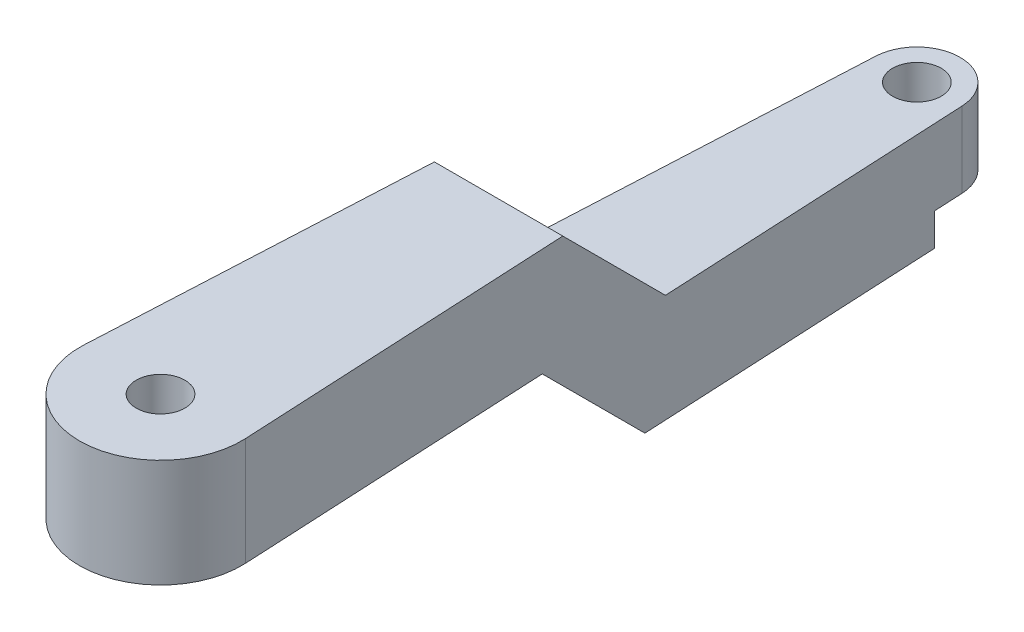
from build123d import *

# Parameters (mm, degrees)
SKETCH1_R           = 1.125
BOSS_EXTRUDE1_DEPTH = 10
CUT_EXTRUDE1_START  = -5
SKETCH2_R           = 1.125
CUT_EXTRUDE1_DEPTH  = 5
CUT_EXTRUDE3_START  = -10
SKETCH2_4_R         = 1.125
CUT_EXTRUDE3_DEPTH  = 5
CHAMFER1_SIZE       = 5
CUT_EXTRUDE4_DEPTH  = 1.5


with BuildPart() as part:
    # Sketch1 → Boss-Extrude1 (new body)
    with BuildSketch(Plane(origin=(0, 0, 0), x_dir=(1, 0, 0), z_dir=(0, 1, 0))):
        with BuildLine():
            ThreePointArc((-3.745309567, 0.1875), (0, -3.75), (3.745309567, 0.1875))
            Line((3.745309567, 0.1875), (1.997498436, 35.1))
            ThreePointArc((1.997498436, 35.1), (0, 37), (-1.997498436, 35.1))
            Line((-1.997498436, 35.1), (-3.745309567, 0.1875))
        make_face()
        with Locations(Location((0, 0, 0), (0, 0, 270))):
            Circle(SKETCH1_R, mode=Mode.SUBTRACT)
        with Locations(Location((0, 35, 0), (0, 0, 270))):
            Circle(SKETCH1_R, mode=Mode.SUBTRACT)
    extrude(amount=BOSS_EXTRUDE1_DEPTH)

    # Sketch2 → Cut-Extrude1 (cut)
    with BuildSketch(Plane(origin=(0, 10, 0), x_dir=(1, 0, 0), z_dir=(0, 1, 0)).offset(CUT_EXTRUDE1_START)):
        with BuildLine():
            Line((-1.997498436, 35.1), (-2.721216149, 20.64375))
            Line((-2.721216149, 20.64375), (2.721216149, 20.64375))
            Line((2.721216149, 20.64375), (1.997498436, 35.1))
            ThreePointArc((1.997498436, 35.1), (0, 37), (-1.997498436, 35.1))
        make_face()
        with Locations(Location((0, 35, 0), (0, 0, 270))):
            Circle(SKETCH2_R, mode=Mode.SUBTRACT)
    extrude(amount=CUT_EXTRUDE1_DEPTH, mode=Mode.SUBTRACT)

    # Sketch2<4> → Cut-Extrude3 (cut)
    # profile 1 of 2: a face of its own
    with BuildSketch(Plane(origin=(0, 10, 0), x_dir=(1, 0, 0), z_dir=(0, 1, 0)).offset(CUT_EXTRUDE3_START)):
        with BuildLine():
            ThreePointArc((3.745309567, 0.1875), (0, 3.75), (-3.745309567, 0.1875))
            ThreePointArc((-3.745309567, 0.1875), (-0.093779329, -3.748827208), (3.75, 0))
            ThreePointArc((3.75, 0), (3.748827208, 0.093779329), (3.745309567, 0.1875))
        make_face()
        with Locations(Location((0, 0, 0), (0, 0, 270))):
            Circle(SKETCH2_4_R, mode=Mode.SUBTRACT)
    # profile 2 of 2: a face of its own
    with BuildSketch(Plane(origin=(0, 10, 0), x_dir=(1, 0, 0), z_dir=(0, 1, 0)).offset(CUT_EXTRUDE3_START)):
        with BuildLine():
            Line((3.021591853, 14.64375), (-3.021591853, 14.64375))
            Line((-3.021591853, 14.64375), (-3.745309567, 0.1875))
            ThreePointArc((-3.745309567, 0.1875), (0, 3.75), (3.745309567, 0.1875))
            Line((3.745309567, 0.1875), (3.021591853, 14.64375))
        make_face()
    extrude(amount=CUT_EXTRUDE3_DEPTH, mode=Mode.SUBTRACT)

    # Chamfer1
    chamfer1_edges = [part.edges().sort_by_distance(p)[0] for p in [
        (0, 0, -14.64375),
        (0, 10, -20.64375),
    ]]
    chamfer(chamfer1_edges, length=CHAMFER1_SIZE - 0.0001)  # a hair under: the kernel refuses the full size

    # Sketch3 → Cut-Extrude4 (cut)
    with BuildSketch(Plane.XZ):
        Polygon((0, -32.546261356), (-2.125, -33.773130678), (-2.125, -36.226869322), (0, -37.453738644), (2.125, -36.226869322), (2.125, -33.773130678), align=None)
    extrude(amount=-CUT_EXTRUDE4_DEPTH, mode=Mode.SUBTRACT)


solid = part.part
